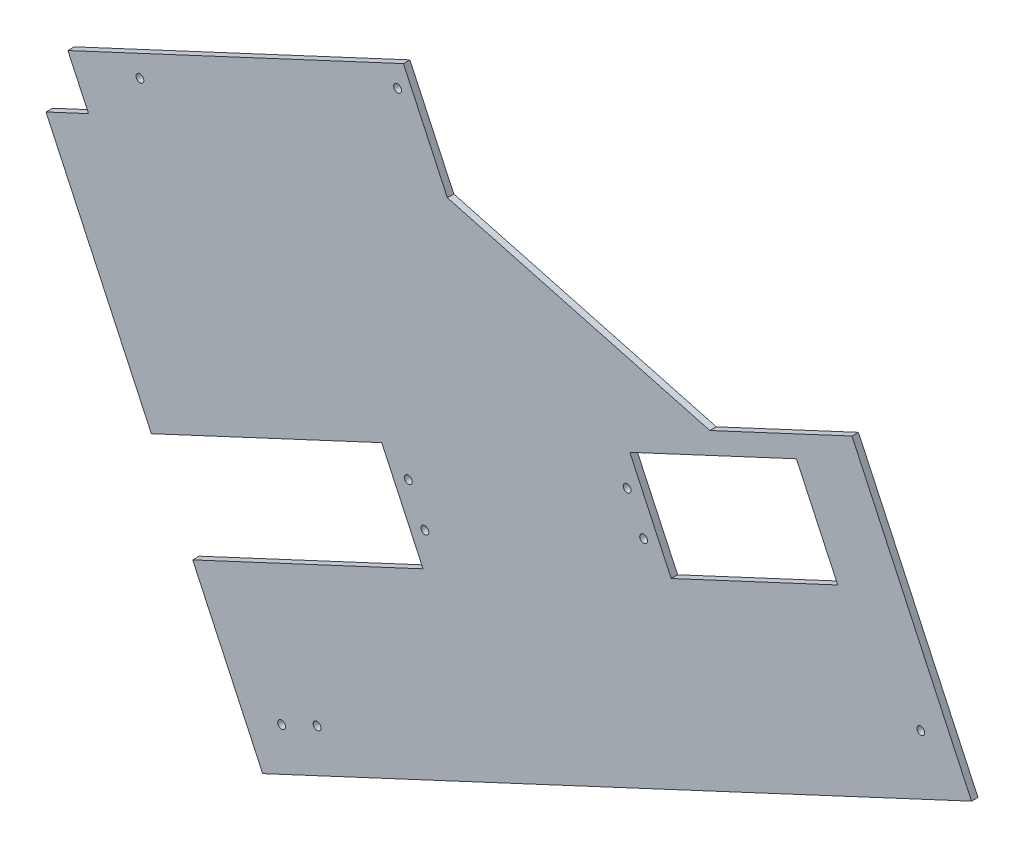
from build123d import *

# Parameters (mm, degrees)
SKETCH1_R           = 2
BOSS_EXTRUDE1_DEPTH = 3.3
SKETCH2_R           = 2
CUT_EXTRUDE1_DEPTH  = 513.420535354
SKETCH3_R           = 2
CUT_EXTRUDE2_DEPTH  = 4
CUT_EXTRUDE3_DEPTH  = 10
SKETCH5_R           = 2
CUT_EXTRUDE4_DEPTH  = 10


with BuildPart() as part:
    # Sketch1 → Boss-Extrude1 (new body)
    with BuildSketch(Plane.XY):
        Polygon((398.70102939, -152.824415428), (337.548166916, -21.681678643), (264.884837628, -55.565145558), (130.636566305, -19.593429672), (108.169003487, 28.58841428), (-63.446663307, -51.437285405), (-52.881206764, -74.094980081), (-74.632593653, -84.237818363), (36.177914576, -321.871720124), align=None)
        with Locations((372.759364157, -134.57831982)):
            Circle(SKETCH1_R, mode=Mode.SUBTRACT)
    extrude(amount=BOSS_EXTRUDE1_DEPTH)

    # Sketch2 → Cut-Extrude1 (cut, through all)
    with BuildSketch(Plane.XY.offset(3.3)):
        with Locations((105.144723808, 16.144390316)):
            Circle(SKETCH2_R)
        with Locations((-26.593400357, -45.286105853)):
            Circle(SKETCH2_R)
    extrude(amount=-CUT_EXTRUDE1_DEPTH, mode=Mode.SUBTRACT)

    # Sketch3 → Cut-Extrude2 (cut)
    with BuildSketch(Plane.XY.offset(3.3)):
        with Locations((45.851705082, -295.293199148)):
            Circle(SKETCH3_R)
        with Locations((63.977860822, -286.840833914)):
            Circle(SKETCH3_R)
    extrude(amount=-CUT_EXTRUDE2_DEPTH, mode=Mode.SUBTRACT)

    # Sketch4 → Cut-Extrude3 (cut)
    with BuildSketch(Plane.XY.offset(3.3)):
        Polygon((330.278182288, -91.274403288), (309.1472692, -45.959013937), (223.954337219, -85.68513054), (245.085250306, -131.000519892), align=None)
        Polygon((118.202160121, -190.167076536), (97.071247034, -144.851687184), (-20.748765281, -199.79206121), (0.382147806, -245.107450562), align=None)
    extrude(amount=-CUT_EXTRUDE3_DEPTH, mode=Mode.SUBTRACT)

    # Sketch5 → Cut-Extrude4 (cut)
    with BuildSketch(Plane.XY.offset(3.3)):
        with Locations((231.008999848, -120.406856639)):
            Circle(SKETCH5_R)
        with Locations((222.556634613, -102.280700898)):
            Circle(SKETCH5_R)
        with Locations((119.134982639, -172.574567612)):
            Circle(SKETCH5_R)
        with Locations((110.682617404, -154.448411871)):
            Circle(SKETCH5_R)
    extrude(amount=-CUT_EXTRUDE4_DEPTH, mode=Mode.SUBTRACT)


solid = part.part
